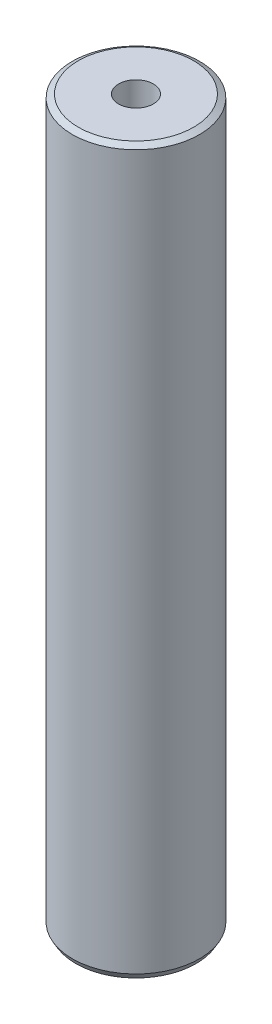
from build123d import *
from OCP.BRepFilletAPI import BRepFilletAPI_MakeChamfer

# Parameters (mm, degrees)
SKETCH1_R           = 12.5
BOSS_EXTRUDE1_DEPTH = 142.1989844
SKETCH2_R           = 3.41898681
CUT_EXTRUDE1_DEPTH  = 144.293583822
CHAMFER1_SIZE       = 0.670369784
CHAMFER1_SIZE2      = 1.161114527


with BuildPart() as part:
    # Sketch1 → Boss-Extrude1 (new body)
    with BuildSketch(Plane(origin=(0, 0, 0), x_dir=(1, 0, 0), z_dir=(0, 1, 0))):
        Circle(SKETCH1_R)
    extrude(amount=BOSS_EXTRUDE1_DEPTH)

    # Sketch2 → Cut-Extrude1 (cut, through all)
    with BuildSketch(Plane(origin=(0, 0, 0), x_dir=(1, 0, 0), z_dir=(0, 1, 0))):
        Circle(SKETCH2_R)
    extrude(amount=CUT_EXTRUDE1_DEPTH, mode=Mode.SUBTRACT)

    # Chamfer1: one chamfer whose edges measure the first distance from different faces: ONE call of the kernel's chamfer builder (chamfer() names one face for all edges)
    chamfer1_edges_1 = [part.edges().sort_by_distance(p)[0] for p in [
        (-12.5, 142.1989844, 0),
    ]]
    chamfer1_side_1 = [part.faces().sort_by_distance(p)[0] for p in [
        (-12.5, 71.0994922, 0),
    ]]
    chamfer1_edges_2 = [part.edges().sort_by_distance(p)[0] for p in [
        (-12.5, 0, 0),
    ]]
    chamfer1_side_2 = [part.faces().sort_by_distance(p)[0] for p in [
        (-12.146446609, 0, 0),
    ]]
    chamfer1 = BRepFilletAPI_MakeChamfer(part.part.solid().wrapped)
    for e in chamfer1_edges_1:
        chamfer1.Add(CHAMFER1_SIZE, CHAMFER1_SIZE2, e.wrapped, chamfer1_side_1[0].wrapped)  # the first distance lies on this face
    for e in chamfer1_edges_2:
        chamfer1.Add(CHAMFER1_SIZE, CHAMFER1_SIZE2, e.wrapped, chamfer1_side_2[0].wrapped)  # the first distance lies on this face
    add(Compound.cast(chamfer1.Shape()), mode=Mode.REPLACE)


solid = part.part
